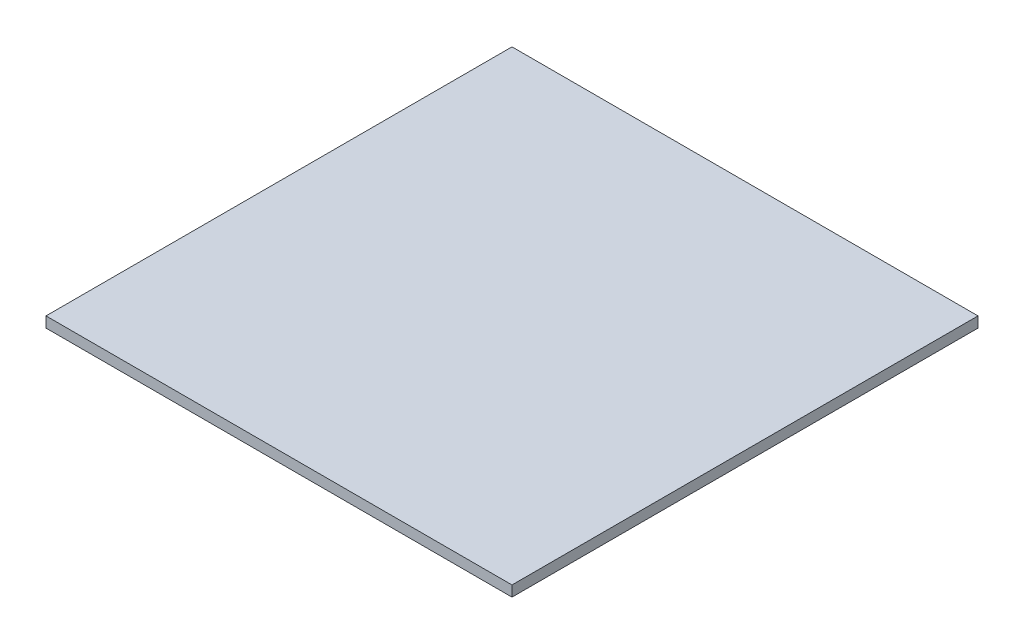
from build123d import *

# Parameters (mm, degrees)
SKETCH1_W           = 558.8
SKETCH1_H           = 558.8
BOSS_EXTRUDE1_DEPTH = 12.7


with BuildPart() as part:
    # Sketch1 → Boss-Extrude1 (new body)
    with BuildSketch(Plane(origin=(0, 0, 0), x_dir=(1, 0, 0), z_dir=(0, 1, 0))):
        with Locations((-260.00984602, 279.4)):
            Rectangle(SKETCH1_W, SKETCH1_H)
    extrude(amount=BOSS_EXTRUDE1_DEPTH)


solid = part.part
